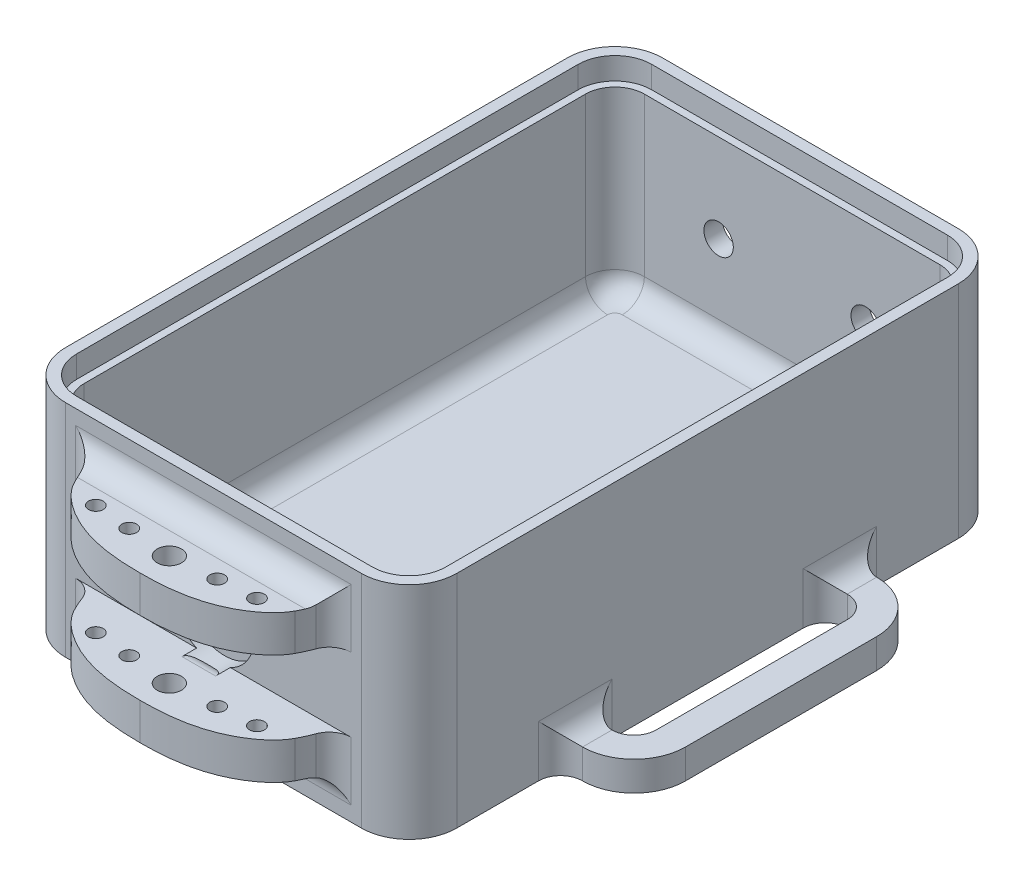
from build123d import *

# Parameters (mm, degrees)
BOSS_EXTRUDE1_DEPTH      = 30
BOSS_EXTRUDE2_DEPTH      = 27
BOSS_EXTRUDE3_DEPTH      = 2.5
FILLET1_R                = 3
BORNIER_REACH            = 92.559
SKETCH3_R                = 2
BOSS_EXTRUDE4_DEPTH      = 4
FILLET2_R                = 3
FILLET3_R                = 7
BOSS_EXTRUDE6_DEPTH      = 10
BOSS_EXTRUDE6_DEPTH_BACK = 10
SKETCH5_R                = 1.65
SKETCH5_R_2              = 1
CUT_EXTRUDE2_DEPTH       = 70.28195973
CUT_EXTRUDE2_DEPTH_BACK  = 70.28195973
SKETCH6_W                = 10.000691042
SKETCH6_H                = 10
FILLET4_R                = 3
CUT_EXTRUDE3_DEPTH       = 1.5
CUT_EXTRUDE4_REACH       = 95.984
SKETCH7_3_W              = 4
SKETCH7_3_H              = 6
FILLET5_R                = 2


# Some blends are built 0.0001 mm under size
with BuildPart() as part:
    # Sketch1 → Boss-Extrude1 (new body)
    with BuildSketch(Plane(origin=(0, 0, 0), x_dir=(1, 0, 0), z_dir=(0, 1, 0))):
        with BuildLine():
            Line((-20.1, 40.6), (20.1, 40.6))
            ThreePointArc((20.1, 40.6), (24.696194078, 38.696194078), (26.6, 34.1))
            Line((26.6, 34.1), (26.6, -34.1))
            ThreePointArc((26.6, -34.1), (24.696194078, -38.696194078), (20.1, -40.6))
            Line((20.1, -40.6), (-20.1, -40.6))
            ThreePointArc((-20.1, -40.6), (-24.696194078, -38.696194078), (-26.6, -34.1))
            Line((-26.6, -34.1), (-26.6, 34.1))
            ThreePointArc((-26.6, 34.1), (-24.696194078, 38.696194078), (-20.1, 40.6))
        make_face()
        with BuildLine():
            ThreePointArc((-20.1, 39.1), (-23.635533906, 37.635533906), (-25.1, 34.1))
            Line((-25.1, 34.1), (-25.1, -34.1))
            ThreePointArc((-25.1, -34.1), (-23.635533906, -37.635533906), (-20.1, -39.1))
            Line((-20.1, -39.1), (20.1, -39.1))
            ThreePointArc((20.1, -39.1), (23.635533906, -37.635533906), (25.1, -34.1))
            Line((25.1, -34.1), (25.1, 34.1))
            ThreePointArc((25.1, 34.1), (23.635533906, 37.635533906), (20.1, 39.1))
            Line((20.1, 39.1), (-20.1, 39.1))
        make_face(mode=Mode.SUBTRACT)
    extrude(amount=BOSS_EXTRUDE1_DEPTH)

    # Sketch1<3> → Boss-Extrude2 (add)
    with BuildSketch(Plane(origin=(0, 0, 0), x_dir=(1, 0, 0), z_dir=(0, 1, 0))):
        with BuildLine():
            Line((-20.1, 39.1), (20.1, 39.1))
            ThreePointArc((20.1, 39.1), (23.635533906, 37.635533906), (25.1, 34.1))
            Line((25.1, 34.1), (25.1, -34.1))
            ThreePointArc((25.1, -34.1), (23.635533906, -37.635533906), (20.1, -39.1))
            Line((20.1, -39.1), (-20.1, -39.1))
            ThreePointArc((-20.1, -39.1), (-23.635533906, -37.635533906), (-25.1, -34.1))
            Line((-25.1, -34.1), (-25.1, 34.1))
            ThreePointArc((-25.1, 34.1), (-23.635533906, 37.635533906), (-20.1, 39.1))
        make_face()
        with BuildLine():
            ThreePointArc((-20.1, 38.1), (-22.928427125, 36.928427125), (-24.1, 34.1))
            Line((-24.1, 34.1), (-24.1, -34.1))
            ThreePointArc((-24.1, -34.1), (-22.928427125, -36.928427125), (-20.1, -38.1))
            Line((-20.1, -38.1), (20.1, -38.1))
            ThreePointArc((20.1, -38.1), (22.928427125, -36.928427125), (24.1, -34.1))
            Line((24.1, -34.1), (24.1, 34.1))
            ThreePointArc((24.1, 34.1), (22.928427125, 36.928427125), (20.1, 38.1))
            Line((20.1, 38.1), (-20.1, 38.1))
        make_face(mode=Mode.SUBTRACT)
    extrude(amount=BOSS_EXTRUDE2_DEPTH)

    # Sketch1<4> → Boss-Extrude3 (add)
    with BuildSketch(Plane(origin=(0, 0, 0), x_dir=(1, 0, 0), z_dir=(0, 1, 0))):
        with BuildLine():
            Line((-20.1, 38.1), (20.1, 38.1))
            ThreePointArc((20.1, 38.1), (22.928427125, 36.928427125), (24.1, 34.1))
            Line((24.1, 34.1), (24.1, -34.1))
            ThreePointArc((24.1, -34.1), (22.928427125, -36.928427125), (20.1, -38.1))
            Line((20.1, -38.1), (-20.1, -38.1))
            ThreePointArc((-20.1, -38.1), (-22.928427125, -36.928427125), (-24.1, -34.1))
            Line((-24.1, -34.1), (-24.1, 34.1))
            ThreePointArc((-24.1, 34.1), (-22.928427125, 36.928427125), (-20.1, 38.1))
        make_face()
    extrude(amount=BOSS_EXTRUDE3_DEPTH)

    # Fillet1
    fillet1_edges = [part.edges().sort_by_distance(p)[0] for p in [
        (22.928427125, 2.5, 36.928427125),
        (-22.928427125, 2.5, -36.928427125),
        (0, 2.5, 38.1),
        (24.1, 2.5, 0),
        (22.928427125, 2.5, -36.928427125),
        (0, 2.5, -38.1),
        (-24.1, 2.5, 0),
        (-22.928427125, 2.5, 36.928427125),
    ]]
    fillet(fillet1_edges, radius=FILLET1_R)

    # Sketch3 → Bornier (cut, up to next)
    with BuildSketch(Plane(origin=(0, 0, -40.6), x_dir=(-1, 0, 0), z_dir=(0, 0, -1)), mode=Mode.PRIVATE) as bornier_sk1:
        with Locations((-10, 15)):
            Circle(SKETCH3_R)
    bornier_tool1 = extrude(bornier_sk1.sketch, amount=-BORNIER_REACH, mode=Mode.PRIVATE) & part.part
    # Sketch3 → Bornier (cut, up to next)
    with BuildSketch(Plane(origin=(0, 0, -40.6), x_dir=(-1, 0, 0), z_dir=(0, 0, -1)), mode=Mode.PRIVATE) as bornier_sk2:
        with Locations((10, 15)):
            Circle(SKETCH3_R)
    bornier_tool2 = extrude(bornier_sk2.sketch, amount=-BORNIER_REACH, mode=Mode.PRIVATE) & part.part
    add(bornier_tool1.solids().sort_by_distance((10, 15, -40.6))[0], mode=Mode.SUBTRACT)
    add(bornier_tool2.solids().sort_by_distance((-10, 15, -40.6))[0], mode=Mode.SUBTRACT)

    # Sketch4 → Boss-Extrude4 (add)
    with BuildSketch(Plane.XZ):
        Polygon((26.6, 16), (32.6, 16), (32.6, -16), (26.6, -16), (26.6, -20), (36.6, -20), (36.6, 20), (26.6, 20), align=None)
        Polygon((-26.6, 16), (-26.6, 20), (-36.6, 20), (-36.6, -20), (-26.6, -20), (-26.6, -16), (-32.6, -16), (-32.6, 16), align=None)
    extrude(amount=-BOSS_EXTRUDE4_DEPTH)

    # Fillet2
    fillet2_edges = [part.edges().sort_by_distance(p)[0] for p in [
        (32.6, 2, 16),
        (32.6, 2, -16),
        (26.6, 2, -20),
        (26.6, 2, -16),
        (26.6, 4, -18),
        (26.6, 4, 18),
        (26.6, 2, 20),
        (26.6, 2, 16),
        (-32.6, 2, -16),
        (-26.6, 2, -20),
        (-26.6, 4, -18),
        (-26.6, 2, -16),
        (-26.6, 4, 18),
        (-26.6, 2, 20),
        (-26.6, 2, 16),
        (-32.6, 2, 16),
    ]]
    fillet(fillet2_edges, radius=FILLET2_R - 0.0001)  # a hair under: the kernel refuses the full size

    # Fillet3
    fillet3_edges = [part.edges().sort_by_distance(p)[0] for p in [
        (-36.6, 2, -20),
        (-36.6, 2, 20),
        (36.6, 2, -20),
        (36.6, 2, 20),
    ]]
    fillet(fillet3_edges, radius=FILLET3_R)

    # Sketch5 → Boss-Extrude6 (add, two sides: drawn at the far end of the back side and taken through both)
    with BuildSketch(Plane(origin=(0, 15, 0), x_dir=(-1, 0, 0), z_dir=(0, -1, 0)).offset(-BOSS_EXTRUDE6_DEPTH_BACK)):
        with BuildLine():
            Line((16.522711642, -40.6), (-16.522711642, -40.6))
            ThreePointArc((-16.522711642, -40.6), (-15.897493185, -42.62243393), (-15.025773528, -44.551486018))
            add(Edge.make_bspline(
                [(-15.025773528, -44.551486018), (-14.228677761, -46.057742891), (-9.345567408, -49.968366267), (-3.844651769, -50.600691042), (0, -50.600691042)],
                knots=[0, 0, 0, 0, 0.327378903, 1, 1, 1, 1], degree=3))
            add(Edge.make_bspline(
                [(15.025773528, -44.551486018), (14.228677761, -46.057742891), (9.345567408, -49.968366267), (3.844651769, -50.600691042), (0, -50.600691042)],
                knots=[0, 0, 0, 0, 0.327378903, 1, 1, 1, 1], degree=3))
            ThreePointArc((15.025773528, -44.551486018), (15.897493185, -42.62243393), (16.522711642, -40.6))
        make_face()
        with Locations(Location((0, -46.6, 0), (0, 0, 90))):
            Circle(SKETCH5_R, mode=Mode.SUBTRACT)
        with Locations(Location((-5.977168189, -46.077065544, 0), (0, 0, 90))):
            Circle(SKETCH5_R_2, mode=Mode.SUBTRACT)
        with Locations(Location((-10.958141679, -45.64128683, 0), (0, 0, 90))):
            Circle(SKETCH5_R_2, mode=Mode.SUBTRACT)
        with Locations(Location((10.958141679, -45.64128683, 0), (0, 0, 270))):
            Circle(SKETCH5_R_2, mode=Mode.SUBTRACT)
        with Locations(Location((5.977168189, -46.077065544, 0), (0, 0, 270))):
            Circle(SKETCH5_R_2, mode=Mode.SUBTRACT)
    extrude(amount=BOSS_EXTRUDE6_DEPTH + BOSS_EXTRUDE6_DEPTH_BACK)

    # Sketch6 → Cut-Extrude2 (cut, two sides: drawn at the far end of the back side and taken through both)
    with BuildSketch(Plane(origin=(0, 0, 0), x_dir=(0, 0, -1), z_dir=(1, 0, 0)).offset(-CUT_EXTRUDE2_DEPTH_BACK)):
        with Locations((-45.600345521, 15)):
            Rectangle(SKETCH6_W, SKETCH6_H)
    extrude(amount=CUT_EXTRUDE2_DEPTH + CUT_EXTRUDE2_DEPTH_BACK, mode=Mode.SUBTRACT)

    # Fillet4
    fillet4_edges = [part.edges().sort_by_distance(p)[0] for p in [
        (-16.522711642, 22.5, 40.6),
        (16.522711642, 22.5, 40.6),
        (0, 25, 40.6),
        (0, 5, 40.6),
        (16.522711642, 7.5, 40.6),
        (-16.522711642, 7.5, 40.6),
    ]]
    fillet(fillet4_edges, radius=FILLET4_R)

    # Sketch7 → Cut-Extrude3 (cut)
    with BuildSketch(Plane.XY.offset(40.6)):
        with BuildLine():
            Line((-6.020797289, 18), (-13, 18))
            Line((-13, 18), (-13, 12))
            Line((-13, 12), (-6.020797289, 12))
            ThreePointArc((-6.020797289, 12), (-4.870349806, 11.770644436), (-3.895810011, 11.117647059))
            ThreePointArc((-3.895810011, 11.117647059), (5.5, 15), (-3.895810011, 18.882352941))
            ThreePointArc((-3.895810011, 18.882352941), (-4.870349806, 18.229355564), (-6.020797289, 18))
        make_face()
    extrude(amount=-CUT_EXTRUDE3_DEPTH, mode=Mode.SUBTRACT)

    # Sketch7<3> → Cut-Extrude4 (cut, up to next)
    with BuildSketch(Plane.XY.offset(40.6), mode=Mode.PRIVATE) as cut_extrude4_sk1:
        with Locations((-11, 15)):
            Rectangle(SKETCH7_3_W, SKETCH7_3_H)
    cut_extrude4_tool1 = extrude(cut_extrude4_sk1.sketch, amount=-CUT_EXTRUDE4_REACH, mode=Mode.PRIVATE) & part.part
    add(cut_extrude4_tool1.solids().sort_by_distance((-11, 15, 40.6))[0], mode=Mode.SUBTRACT)

    # Fillet5
    # the kernel refuses this fillet: 2 mm, written as the material it takes off along each edge
    with BuildSketch(Plane(origin=(-7.291287847, 10, 40.6), x_dir=(0, 0, 1), z_dir=(1, 0, 0))) as fillet5_piece_1_section:
        with BuildLine():
            CenterArc((FILLET5_R, FILLET5_R), FILLET5_R, 180, 90)
            Line((0, FILLET5_R), (-FILLET5_R * 0.02, FILLET5_R))
            Line((-FILLET5_R * 0.02, FILLET5_R), (-FILLET5_R * 0.02, -FILLET5_R * 0.02))
            Line((-FILLET5_R * 0.02, -FILLET5_R * 0.02), (FILLET5_R, -FILLET5_R * 0.02))
            Line((FILLET5_R, -FILLET5_R * 0.02), (FILLET5_R, 0))
        make_face()
    fillet5_piece_1 = extrude(amount=14.582575695, mode=Mode.PRIVATE)
    fillet5_piece_1 = split(fillet5_piece_1, bisect_by=Plane(origin=(-1.49e-07, 9.863484185, 40.6), z_dir=(0, 0, 1)), keep=Keep.TOP, mode=Mode.PRIVATE)
    fillet5_piece_1 = fillet5_piece_1 & Plane(origin=(0, 15, 41.29634072), x_dir=(-0.708329092870135, -0.7058823529411764, 0), z_dir=(0, 0, 1)) * Cylinder(5.5, 38, mode=Mode.PRIVATE)
    add(fillet5_piece_1, mode=Mode.SUBTRACT)
    with BuildSketch(Plane(origin=(7.291287847, 20, 40.6), x_dir=(0, 1, 0), z_dir=(-1, 0, 0))) as fillet5_piece_2_section:
        with BuildLine():
            CenterArc((FILLET5_R, -FILLET5_R), FILLET5_R, 90, 90)
            Line((0, -FILLET5_R), (-FILLET5_R * 0.02, -FILLET5_R))
            Line((-FILLET5_R * 0.02, -FILLET5_R), (-FILLET5_R * 0.02, FILLET5_R * 0.02))
            Line((-FILLET5_R * 0.02, FILLET5_R * 0.02), (FILLET5_R, FILLET5_R * 0.02))
            Line((FILLET5_R, FILLET5_R * 0.02), (FILLET5_R, 0))
        make_face()
    fillet5_piece_2 = extrude(amount=14.582575695, mode=Mode.PRIVATE)
    fillet5_piece_2 = split(fillet5_piece_2, bisect_by=Plane(origin=(1.13e-07, 20.136515828, 40.6), z_dir=(0, 0, 1)), keep=Keep.TOP, mode=Mode.PRIVATE)
    fillet5_piece_2 = fillet5_piece_2 & Plane(origin=(0, 15, 41.29634056), x_dir=(-0.708329092870135, -0.7058823529411764, 0), z_dir=(0, 0, 1)) * Cylinder(5.5, 38, mode=Mode.PRIVATE)
    add(fillet5_piece_2, mode=Mode.SUBTRACT)


solid = part.part
